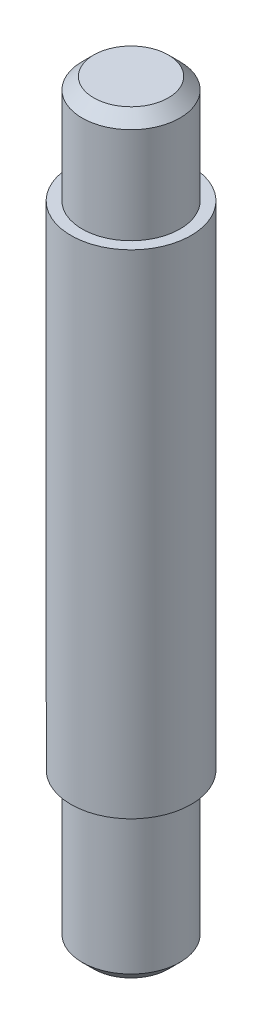
from build123d import *

# Parameters (mm, degrees)
SKETCH1_R           = 3.9
BOSS_EXTRUDE1_DEPTH = 44
BOSS_EXTRUDE2_START = 5
SKETCH6_R           = 3.9
BOSS_EXTRUDE2_DEPTH = 5
CUT_EXTRUDE1_DEPTH  = 8
CUT_EXTRUDE2_DEPTH  = 15


# Read off the part's stored shape, not the designer's step: 1/4-20 Machine Threads Stud2, 1/4-20 Machine Threads Stud4
with BuildPart() as part:
    # Sketch1 → Boss-Extrude1 (new body)
    with BuildSketch(Plane(origin=(0, 0, 0), x_dir=(1, 0, 0), z_dir=(0, 1, 0))):
        with Locations(Location((0, 0, 0), (0, 0, 270))):
            Circle(SKETCH1_R)
    extrude(amount=BOSS_EXTRUDE1_DEPTH)

    # 1/4-20 Machine Threads Stud2 outline → 1/4-20 Machine Threads Stud2 (revolve, cut)
    with BuildSketch(Plane.XY):
        Polygon((3.9, 44), (2.41935, 44), (3.175, 43.24435), (3.175, 37), (3.9, 37), align=None)
    revolve(axis=Axis((0, 0, 0), (0, 1, 0)), mode=Mode.SUBTRACT)

    # Sketch6 → Boss-Extrude2 (add)
    with BuildSketch(Plane.XZ.offset(BOSS_EXTRUDE2_START)):
        with Locations(Location((0, 0, 0), (0, 0, 270))):
            Circle(SKETCH6_R)
    extrude(amount=-BOSS_EXTRUDE2_DEPTH)

    # 1/4-20 Machine Threads Stud4 outline → 1/4-20 Machine Threads Stud4 (revolve, cut)
    with BuildSketch(Plane.XY):
        Polygon((2.41935, -5), (3.9, -5), (3.9, 5), (3.175, 5), (3.175, -4.24435), align=None)
    revolve(axis=Axis((0, 0, 0), (0, 1, 0)), mode=Mode.SUBTRACT)

    # Sketch10 → Cut-Extrude1 (cut)
    with BuildSketch(Plane.XZ.offset(5)):
        with BuildLine():
            Line((-1.269821024, 0.798470142), (1.269821024, 0.798470142))
            ThreePointArc((1.269821024, 0.798470142), (0, -1.5), (-1.269821024, 0.798470142))
        make_face()
    extrude(amount=-CUT_EXTRUDE1_DEPTH, mode=Mode.SUBTRACT)

    # Sketch11 → Cut-Extrude2 (cut)
    with BuildSketch(Plane.XZ.offset(5)):
        with BuildLine():
            Line((-1.839869815, 0.784142248), (0.828669593, 1.820249078))
            ThreePointArc((0.828669593, 1.820249078), (0.723885911, -1.86440049), (-1.839869815, 0.784142248))
        make_face()
    extrude(amount=-CUT_EXTRUDE2_DEPTH, mode=Mode.SUBTRACT)


solid = part.part
